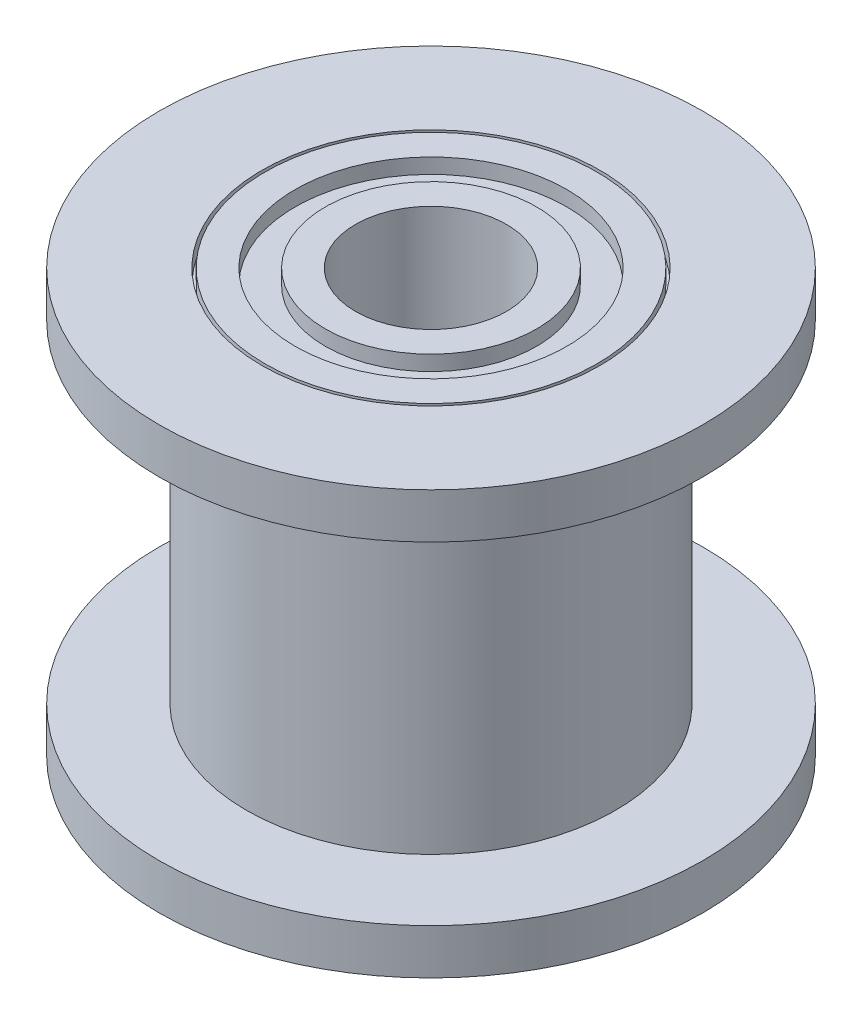
from build123d import *

# Parameters (mm, degrees)
BOSS_EXTRUDE1_OUTLINE_R = 9
BOSS_EXTRUDE1_DEPTH     = 1.5
SKETCH2_R               = 6.1121977
BOSS_EXTRUDE2_DEPTH     = 5.5
SKETCH3_R               = 2.5
CUT_EXTRUDE1_DEPTH      = 19.920887928
SKETCH4_R               = 5.6
SKETCH4_R_2             = 5.5
SKETCH4_R_3             = 4.5
SKETCH4_R_4             = 3.5
CUT_EXTRUDE2_DEPTH      = 0.5


# Read off the part's stored shape, not the designer's step: Boss-Extrude1
with BuildPart() as part:
    # Boss-Extrude1 outline → Boss-Extrude1 (new body)
    with BuildSketch(Plane(origin=(0, 0, 0), x_dir=(1, 0, 0), z_dir=(0, 1, 0))):
        Circle(BOSS_EXTRUDE1_OUTLINE_R)
    boss_extrude1 = extrude(amount=BOSS_EXTRUDE1_DEPTH)

    # Sketch2 → Boss-Extrude2 (add)
    with BuildSketch(Plane(origin=(0, 1.5, 0), x_dir=(1, 0, 0), z_dir=(0, 1, 0))):
        with Locations(Location((0, 0, 0), (0, 0, 270))):
            Circle(SKETCH2_R)
    boss_extrude2 = extrude(amount=BOSS_EXTRUDE2_DEPTH)

    # Mirror1: Boss-Extrude2 across plane
    add(boss_extrude2.mirror(Plane.ZX.offset(7)))

    # Mirror2: Boss-Extrude1 across plane
    add(boss_extrude1.mirror(Plane.ZX.offset(7)))

    # Sketch3 → Cut-Extrude1 (cut, through all)
    with BuildSketch(Plane(origin=(0, 14, 0), x_dir=(1, 0, 0), z_dir=(0, 1, 0))):
        with Locations(Location((0, 0, 0), (0, 0, 270))):
            Circle(SKETCH3_R)
    extrude(amount=-CUT_EXTRUDE1_DEPTH, mode=Mode.SUBTRACT)

    # Sketch4 → Cut-Extrude2 (cut)
    # profile 1 of 2: a face of its own
    with BuildSketch(Plane(origin=(0, 14, 0), x_dir=(1, 0, 0), z_dir=(0, 1, 0))):
        with Locations(Location((0, 0, 0), (0, 0, 270))):
            Circle(SKETCH4_R)
        with Locations(Location((0, 0, 0), (0, 0, 270))):
            Circle(SKETCH4_R_2, mode=Mode.SUBTRACT)
    # profile 2 of 2: a face of its own
    with BuildSketch(Plane(origin=(0, 14, 0), x_dir=(1, 0, 0), z_dir=(0, 1, 0))):
        with Locations(Location((0, 0, 0), (0, 0, 270))):
            Circle(SKETCH4_R_3)
        with Locations(Location((0, 0, 0), (0, 0, 270))):
            Circle(SKETCH4_R_4, mode=Mode.SUBTRACT)
    cut_extrude2 = extrude(amount=-CUT_EXTRUDE2_DEPTH, mode=Mode.SUBTRACT)

    # Mirror3: Cut-Extrude2 across plane
    add(cut_extrude2.mirror(Plane.ZX.offset(7)), mode=Mode.SUBTRACT)


solid = part.part
